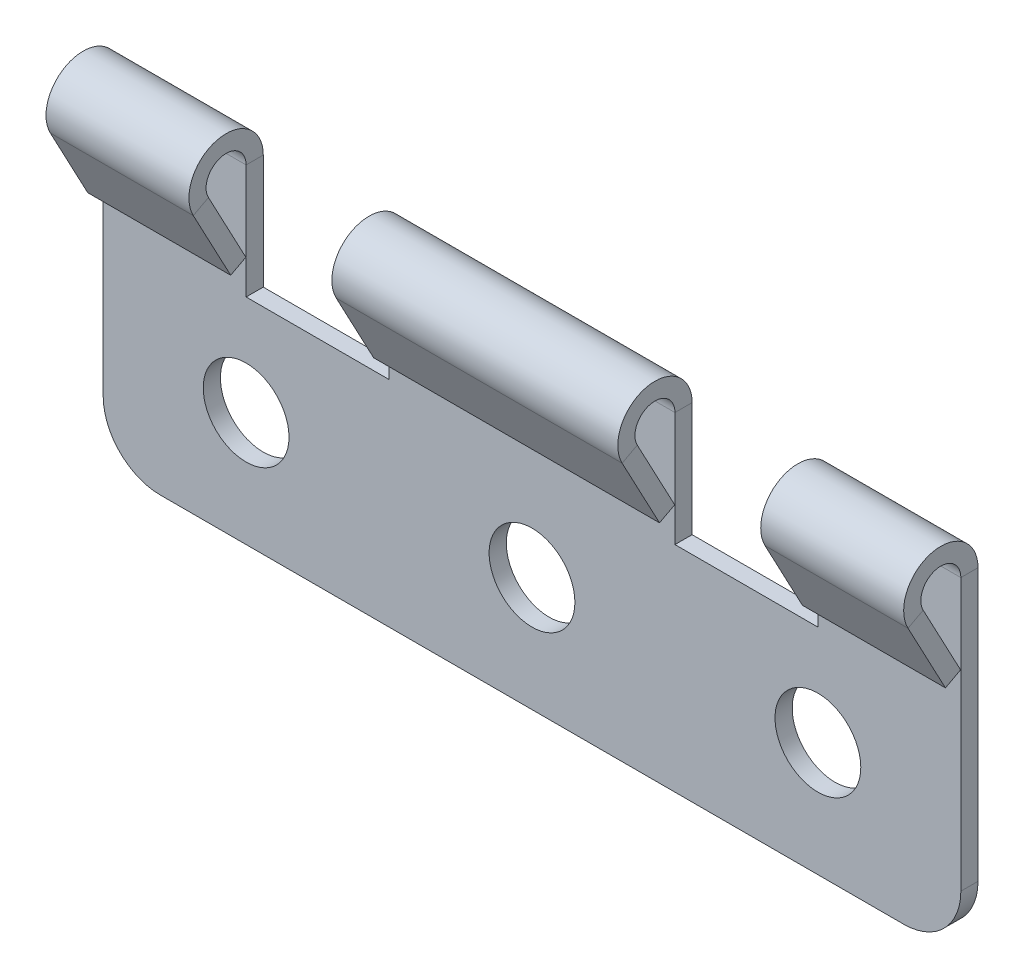
from build123d import *

# Parameters (mm, degrees)
BASE_FLANGE1_DEPTH = 6
HEM1_START         = -50
HEM1_DEPTH         = 100
HEM1_START_2       = -150
HEM1_2_DEPTH       = 50
HEM1_START_3       = 100
HEM1_3_DEPTH       = 50
SKETCH14_R         = 15
CUT_EXTRUDE1_DEPTH = 10


# Read off the part's stored shape, not the designer's step: Hem1
# Sheet-metal steps are written as plain solids
with BuildPart() as part:
    # Sketch1 → Base-Flange1 (new body)
    with BuildSketch(Plane.XY):
        with BuildLine():
            Line((100, 75), (50, 75))
            Line((50, 75), (50, 115))
            Line((50, 115), (-50, 115))
            Line((-50, 115), (-50, 75))
            Line((-50, 75), (-100, 75))
            Line((-100, 75), (-100, 115))
            Line((-100, 115), (-150, 115))
            Line((-150, 115), (-150, 20))
            ThreePointArc((-150, 20), (-144.142135624, 5.857864376), (-130, 0))
            Line((-130, 0), (130, 0))
            ThreePointArc((130, 0), (144.142135624, 5.857864376), (150, 20))
            Line((150, 20), (150, 115))
            Line((150, 115), (100, 115))
            Line((100, 115), (100, 75))
        make_face()
    extrude(amount=-BASE_FLANGE1_DEPTH)

    # Hem1 outline → Hem1 (add)
    with BuildSketch(Plane.YZ.offset(HEM1_START)):
        with BuildLine():
            Line((84.284293607, 5.39157987), (87.101122984, 0.093894313))
            Line((87.101122984, 0.093894313), (111.71369906, 13.18063315))
            ThreePointArc((111.71369906, 13.18063315), (121.792070084, 8.69345327), (115, 0))
            Line((115, 0), (115, -6))
            ThreePointArc((115, -6), (127.613844442, 10.144984643), (108.896869684, 18.478318707))
            Line((108.896869684, 18.478318707), (84.284293607, 5.39157987))
        make_face()
    extrude(amount=HEM1_DEPTH)

    # Hem1 2 outline → Hem1 2 (add)
    with BuildSketch(Plane.YZ.offset(HEM1_START_2)):
        with BuildLine():
            Line((84.284293607, 5.39157987), (87.101122984, 0.093894313))
            Line((87.101122984, 0.093894313), (111.71369906, 13.18063315))
            ThreePointArc((111.71369906, 13.18063315), (121.792070084, 8.69345327), (115, 0))
            Line((115, 0), (115, -6))
            ThreePointArc((115, -6), (127.613844442, 10.144984643), (108.896869684, 18.478318707))
            Line((108.896869684, 18.478318707), (84.284293607, 5.39157987))
        make_face()
    extrude(amount=HEM1_2_DEPTH)

    # Hem1 3 outline → Hem1 3 (add)
    with BuildSketch(Plane.YZ.offset(HEM1_START_3)):
        with BuildLine():
            Line((84.284293607, 5.39157987), (87.101122984, 0.093894313))
            Line((87.101122984, 0.093894313), (111.71369906, 13.18063315))
            ThreePointArc((111.71369906, 13.18063315), (121.792070084, 8.69345327), (115, 0))
            Line((115, 0), (115, -6))
            ThreePointArc((115, -6), (127.613844442, 10.144984643), (108.896869684, 18.478318707))
            Line((108.896869684, 18.478318707), (84.284293607, 5.39157987))
        make_face()
    extrude(amount=HEM1_3_DEPTH)

    # Sketch14 → Cut-Extrude1 (cut)
    with BuildSketch(Plane.XY):
        with Locations((100, 40)):
            Circle(SKETCH14_R)
        with Locations((0, 40)):
            Circle(SKETCH14_R)
        with Locations((-100, 40)):
            Circle(SKETCH14_R)
    extrude(amount=-CUT_EXTRUDE1_DEPTH, mode=Mode.SUBTRACT)


solid = part.part
